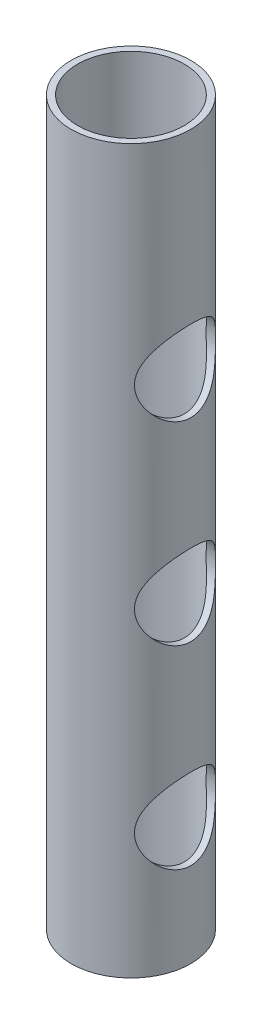
from build123d import *

# Parameters (mm, degrees)
SKETCH1_R           = 18.5
SKETCH1_R_2         = 16.5
BOSS_EXTRUDE1_DEPTH = 223.5
SKETCH2_R           = 12.53
CUT_EXTRUDE1_DEPTH  = 226.026109596


with BuildPart() as part:
    # Sketch1 → Boss-Extrude1 (new body)
    with BuildSketch(Plane(origin=(0, 0, 0), x_dir=(1, 0, 0), z_dir=(0, 1, 0))):
        Circle(SKETCH1_R)
        Circle(SKETCH1_R_2, mode=Mode.SUBTRACT)
    extrude(amount=BOSS_EXTRUDE1_DEPTH)

    # Sketch2 → Cut-Extrude1 (cut, through all)
    with BuildSketch(Plane(origin=(0, 0, 0), x_dir=(0, 0, -1), z_dir=(1, 0, 0))):
        with Locations((0, 158.8)):
            Circle(SKETCH2_R)
        with Locations((0, 98.8)):
            Circle(SKETCH2_R)
        with Locations((0, 38.8)):
            Circle(SKETCH2_R)
    extrude(amount=CUT_EXTRUDE1_DEPTH, mode=Mode.SUBTRACT)


solid = part.part
